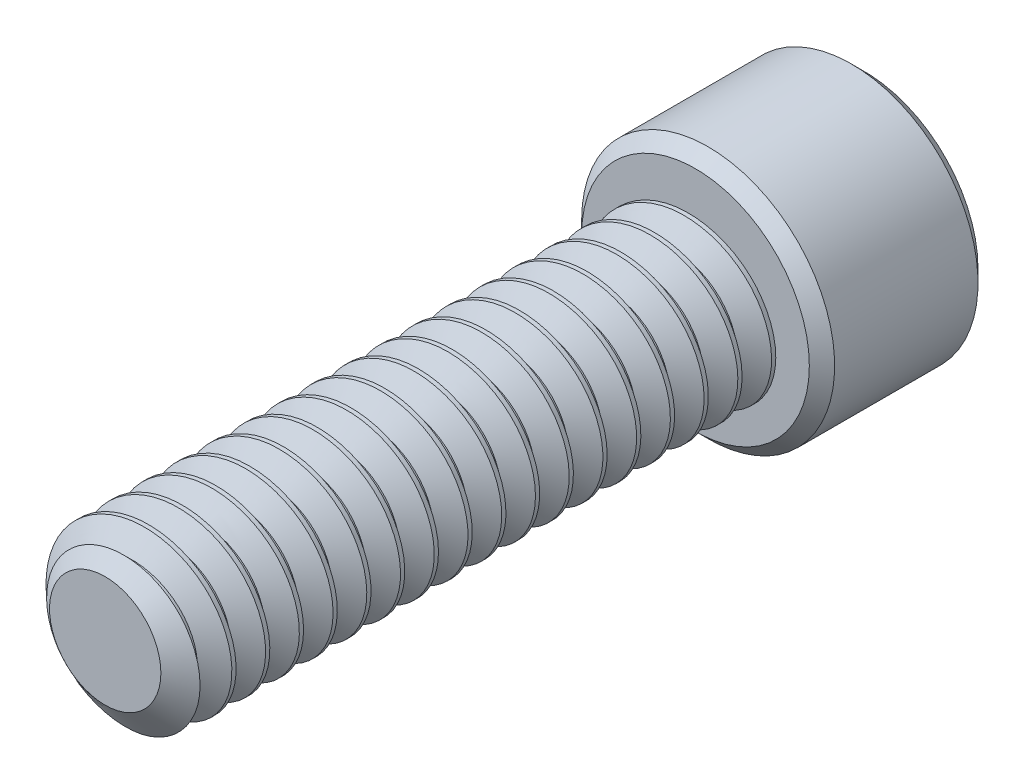
from build123d import *

# Parameters (mm, degrees)
SKETCH1_R          = 3.175
EXTRUDE1_DEPTH     = 22.225
CUT_SWEEP1_PITCH   = 1.27
SKETCH6_R          = 4.7625
EXTRUDE2_DEPTH     = 6.35
CUT_EXTRUDE1_DEPTH = 3.571875
CHAMFER1_SIZE      = 0.47625


with BuildPart() as part:
    # Sketch1 → Extrude1 (new body)
    with BuildSketch(Plane.XY):
        Circle(SKETCH1_R)
    extrude(amount=-EXTRUDE1_DEPTH)

    # Cut-Sweep1: the profile of Sketch3 profile screwed along a right-hand helix of 18.5 turns, 6 arcs to a turn; built about Z, then put on its axis
    cut_sweep1_z = Axis((0, 0, 0), (0, 0, 1))
    cut_sweep1_corners = [(3.1753, 0, -1.111423205), (2.350110803, 0, -0.635), (2.350110803, 0, -0.47625), (3.1753, 0, 0.000173205)]
    with BuildLine(mode=Mode.PRIVATE) as cut_sweep1_profile:
        Line(cut_sweep1_corners[0], cut_sweep1_corners[1])
        Line(cut_sweep1_corners[1], cut_sweep1_corners[2])
        Line(cut_sweep1_corners[2], cut_sweep1_corners[3])
        Line(cut_sweep1_corners[3], cut_sweep1_corners[0])
    cut_sweep1_cap = Face(cut_sweep1_profile.wire())
    cut_sweep1_turn_angles = [0, 30, 60, 90, 120, 150, 180, 210, 240, 270, 300, 330, 360]
    cut_sweep1_turn_weights = [1, 0.8660254037844387, 1, 0.8660254037844387, 1, 0.8660254037844387, 1, 0.8660254037844387, 1, 0.8660254037844387, 1, 0.8660254037844387, 1]
    cut_sweep1_turn_rails = [Edge.make_bspline([Vector(p[0], p[1], 0).rotate(cut_sweep1_z, cut_sweep1_turn_angles[k]) / cut_sweep1_turn_weights[k] + Vector(0, 0, p[2] + CUT_SWEEP1_PITCH * cut_sweep1_turn_angles[k] / 360) for k in range(13)], [0, 0, 0, 1, 1, 2, 2, 3, 3, 4, 4, 5, 5, 6, 6, 6], 2, cut_sweep1_turn_weights) for p in cut_sweep1_corners]
    cut_sweep1_turn_sides = [Face.make_surface_from_curves(cut_sweep1_turn_rails[p[0]], cut_sweep1_turn_rails[p[1]]) for p in [(0, 1), (1, 2), (2, 3), (3, 0)]]
    cut_sweep1_last_angles = [6480, 6510, 6540, 6570, 6600, 6630, 6660]
    cut_sweep1_last_weights = [1, 0.8660254037844387, 1, 0.8660254037844387, 1, 0.8660254037843156, 1]
    cut_sweep1_last_rails = [Edge.make_bspline([Vector(p[0], p[1], 0).rotate(cut_sweep1_z, cut_sweep1_last_angles[k]) / cut_sweep1_last_weights[k] + Vector(0, 0, p[2] + CUT_SWEEP1_PITCH * cut_sweep1_last_angles[k] / 360) for k in range(7)], [0, 0, 0, 1, 1, 2, 2, 3, 3, 3], 2, cut_sweep1_last_weights) for p in cut_sweep1_corners]
    cut_sweep1_last_sides = [Face.make_surface_from_curves(cut_sweep1_last_rails[p[0]], cut_sweep1_last_rails[p[1]]) for p in [(0, 1), (1, 2), (2, 3), (3, 0)]]
    cut_sweep1 = Plane(origin=(0, 0, 0), x_dir=(0, 1, 0), z_dir=(0, 0, -1)) * Solid(Shell([*[p.moved(Location((0, 0, CUT_SWEEP1_PITCH * i))) for i in range(18) for p in cut_sweep1_turn_sides], *cut_sweep1_last_sides, cut_sweep1_cap, cut_sweep1_cap.rotate(cut_sweep1_z, 6660).moved(Location((0, 0, CUT_SWEEP1_PITCH * 6660 / 360)))]))
    add(cut_sweep1, mode=Mode.SUBTRACT)

    # Sketch4 → Cut-Revolve1 (revolve, cut)
    with BuildSketch(Plane(origin=(0, 0, 0), x_dir=(0, 0, -1), z_dir=(1, 0, 0)), mode=Mode.PRIVATE) as cut_revolve1_sk:
        Polygon((0.755446349, 3.175), (0, 2.096110803), (0, 3.175), align=None)
    revolve(cut_revolve1_sk.sketch.rotate(Axis((0, 0, 0), (0, 0, -1)), 229.892048011), axis=Axis((0, 0, 0), (0, 0, -1)), mode=Mode.SUBTRACT)

    # Sketch6 → Extrude2 (add)
    with BuildSketch(Plane(origin=(0, 0, -22.225), x_dir=(-1, 0, 0), z_dir=(0, 0, -1))):
        Circle(SKETCH6_R)
    extrude(amount=EXTRUDE2_DEPTH)

    # Sketch7 → Cut-Extrude1 (cut)
    with BuildSketch(Plane(origin=(0, 0, -28.575), x_dir=(-1, 0, 0), z_dir=(0, 0, -1))):
        Polygon((0, 2.749630657), (-2.38125, 1.374815329), (-2.38125, -1.374815329), (0, -2.749630657), (2.38125, -1.374815329), (2.38125, 1.374815329), align=None)
    extrude(amount=-CUT_EXTRUDE1_DEPTH, mode=Mode.SUBTRACT)

    # Cut-Extrude2 cone 1 section (through the dimple's axis) → Cut-Extrude2 (revolve, cut)
    with BuildSketch(Plane(origin=(0, 0, -28.575), x_dir=(0, 1, 0), z_dir=(1, 0, 0))):
        Polygon((0, 0), (2.749630657, 0), (0, 2.749630657), align=None)
    revolve(axis=Axis((0, 0, -28.575), (0, 0, 1)), mode=Mode.SUBTRACT)

    # Chamfer1
    chamfer1_edges = [part.edges().sort_by_distance(p)[0] for p in [
        (4.7625, 0, -22.225),
        (4.7625, 0, -28.575),
    ]]
    chamfer(chamfer1_edges, length=CHAMFER1_SIZE)


solid = part.part
